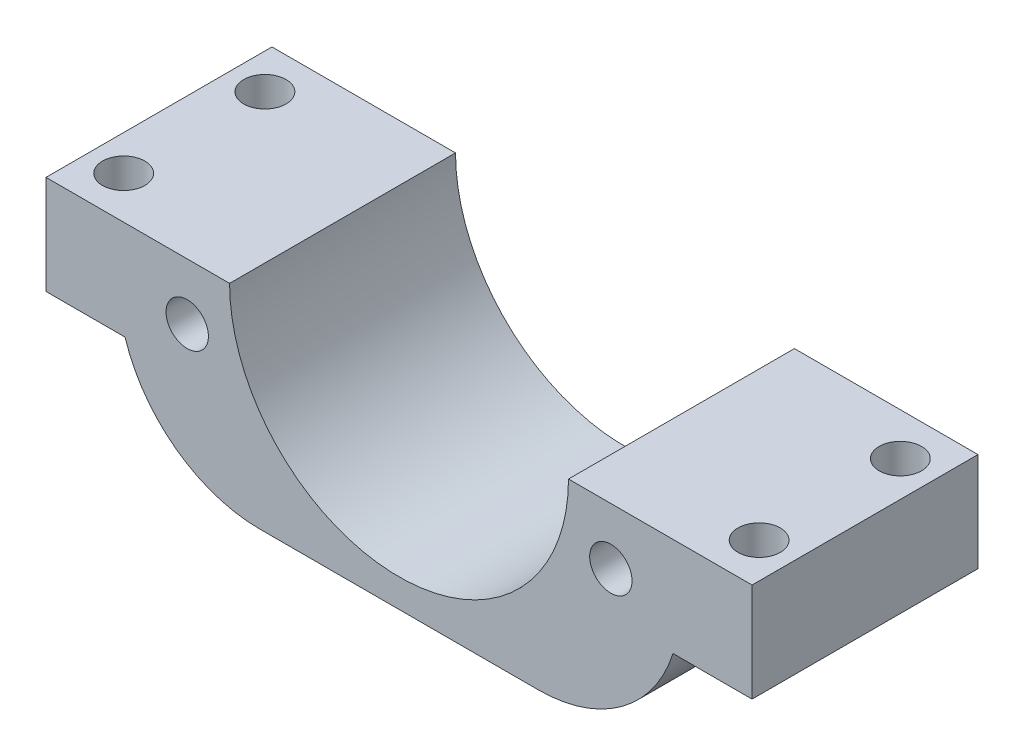
from build123d import *

# Parameters (mm, degrees)
SKETCH7_R            = 1.5
BOSS_EXTRUDE11_DEPTH = 16
SKETCH8_R            = 1.5
CUT_EXTRUDE1_DEPTH   = 52.078371156
FILLET1_R            = 10


with BuildPart() as part:
    # Sketch7 → Boss-Extrude11 (new body)
    with BuildSketch(Plane.XY):
        with BuildLine():
            ThreePointArc((11, 14.9), (23, 2.9), (35, 14.9))
            Line((35, 14.9), (48, 14.9))
            Line((48, 14.9), (48, 7.9))
            Line((48, 7.9), (42.4, 7.9))
            Line((42.4, 7.9), (42.4, 0.9))
            Line((42.4, 0.9), (3.598076211, 0.9))
            Line((3.598076211, 0.9), (3.598076211, 7.9))
            Line((3.598076211, 7.9), (-2, 7.9))
            Line((-2, 7.9), (-2, 14.9))
            Line((-2, 14.9), (11, 14.9))
        make_face()
        with Locations((38, 10.9)):
            Circle(SKETCH7_R, mode=Mode.SUBTRACT)
        with Locations((8, 10.9)):
            Circle(SKETCH7_R, mode=Mode.SUBTRACT)
    extrude(amount=BOSS_EXTRUDE11_DEPTH)

    # Sketch8 → Cut-Extrude1 (cut, through all)
    with BuildSketch(Plane.XZ.offset(-7.9)):
        with Locations(Location((0.5, 13, 0), (0, 0, 270))):
            Circle(SKETCH8_R)
        with Locations(Location((45.5, 13, 0), (0, 0, 270))):
            Circle(SKETCH8_R)
        with Locations(Location((45.5, 3, 0), (0, 0, 270))):
            Circle(SKETCH8_R)
        with Locations(Location((0.5, 3, 0), (0, 0, 270))):
            Circle(SKETCH8_R)
    extrude(amount=-CUT_EXTRUDE1_DEPTH, mode=Mode.SUBTRACT)

    # Fillet1
    # the kernel refuses this fillet: 10 mm, written as the material it takes off along each edge
    with BuildSketch(Plane(origin=(3.598076211, 0.9, -23.848480035), x_dir=(1, 0, 0), z_dir=(0, 0, 1))) as fillet1_piece_1:
        with BuildLine():
            CenterArc((9.539392014, 10), FILLET1_R, 197.457603124, 72.542396876)
            Line((0, 7), (-0.19078784, 6.94))
            ThreePointArc((-0.19078784, 6.94), (-0.2, 3.5), (-0.2, 0))
            Line((-0.2, 0), (0, -0.2))
            Line((0, -0.2), (9.539392014, -0.2))
            Line((9.539392014, -0.2), (9.539392014, 0))
        make_face()
    extrude(amount=63.696960071, mode=Mode.SUBTRACT)
    with BuildSketch(Plane(origin=(42.4, 0.9, -23.848480035), x_dir=(0, 1, 0), z_dir=(0, 0, 1))) as fillet1_piece_2:
        with BuildLine():
            CenterArc((10, 9.539392014), FILLET1_R, 180, 72.542396876)
            Line((0, 9.539392014), (-0.2, 9.539392014))
            Line((-0.2, 9.539392014), (-0.2, 0))
            Line((-0.2, 0), (0, -0.2))
            ThreePointArc((0, -0.2), (3.5, -0.2), (6.94, -0.19078784))
            Line((6.94, -0.19078784), (7, 0))
        make_face()
    extrude(amount=63.696960071, mode=Mode.SUBTRACT)


solid = part.part
